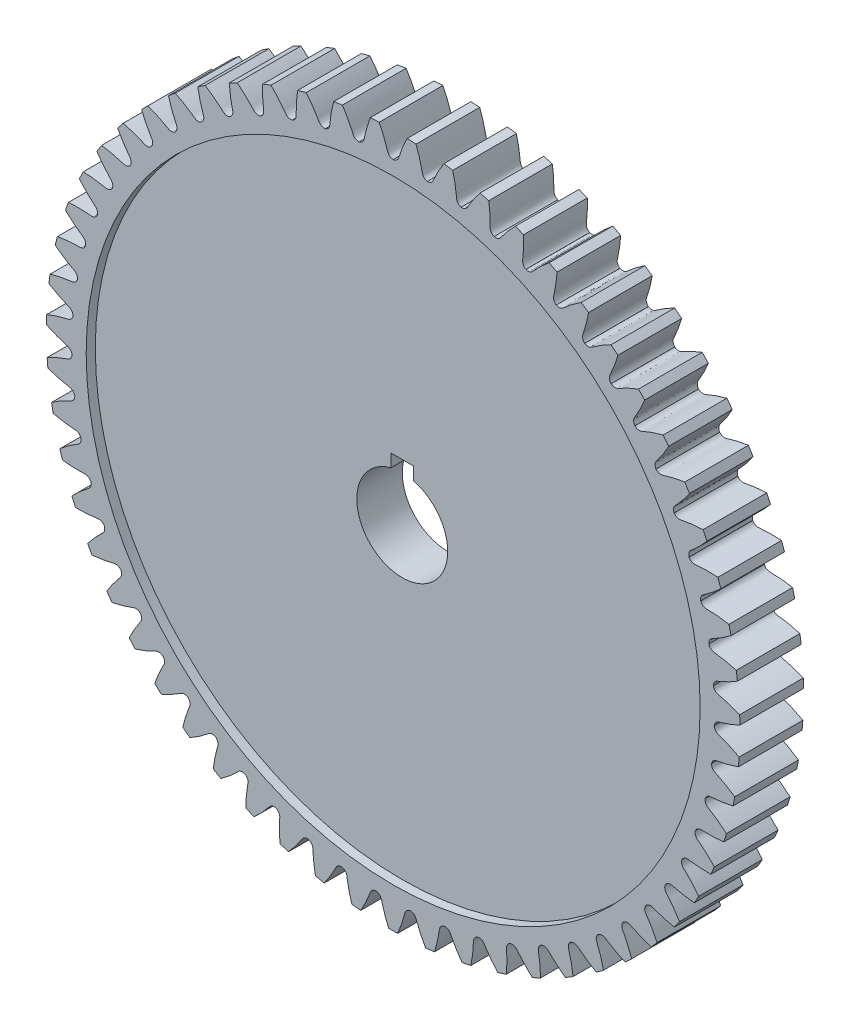
from build123d import *

# Parameters (mm, degrees)
SKETCH_1_R               = 76.25
EXTRUDE_1_DEPTH          = 30
CUT_EXTRUDE_1_DEPTH      = 112.929107028
PATTERN_CIRCULAR_1_COUNT = 59
CUT_EXTRUDE_2_DEPTH      = 60
SKETCH_5_R               = 102.301943374
CUT_EXTRUDE_3_DEPTH      = 16
SKETCH_6_R               = 67.5
CUT_EXTRUDE_4_DEPTH      = 2
CUT_EXTRUDE_START        = -2
SKETCH_7_R               = 67.5
CUT_EXTRUDE_5_DEPTH      = 2


with BuildPart() as part:
    # 草图1 → 凸台-拉伸1 (new body)
    with BuildSketch(Plane.XY):
        Circle(SKETCH_1_R)
    extrude(amount=EXTRUDE_1_DEPTH)

    # 草图2 → 切除-拉伸1 (cut, through all)
    with BuildSketch(Plane.XY):
        with BuildLine():
            ThreePointArc((0.01, 70.624915122), (0, 70.62491583), (-0.01, 70.624915122))
            add(Edge.make_bspline(
                [(-0.01, 70.624915122), (-1.072765247, 70.785715004), (-1.236088685, 71.64790065), (-1.552331687, 72.603417035), (-1.69871856, 73.026171753), (-1.863835529, 73.471498911), (-2.047763265, 73.939358412), (-2.251721525, 74.429004655), (-2.476576338, 74.939860258), (-2.723274787, 75.471261526), (-2.992717662, 76.022532973), (-3.285795326, 76.592966343), (-3.603376394, 77.18182727), (-3.946310034, 77.788353996), (-4.315424358, 78.411758394), (-4.711525962, 79.051226361), (-5.135399146, 79.705918404), (-5.587805243, 80.374970205), (-6.069481938, 81.057493203), (-6.581142606, 81.752575205), (-7.12347567, 82.459281001), (-7.697143946, 83.176653003), (-8.302784102, 83.903711896), (-8.941005772, 84.639457313), (-9.848574602, 85.644388189), (-10.561555039, 86.387164936), (-11.052843393, 86.87944586)],
                knots=[0, 0, 0, 0, 0.108464366, 0.129572035, 0.152074456, 0.17597163, 0.201263556, 0.227950233, 0.256031663, 0.285507845, 0.316378778, 0.348644464, 0.382304902, 0.417360092, 0.453810034, 0.491654728, 0.530894175, 0.571528373, 0.613557323, 0.656981026, 0.70179948, 0.748012687, 0.795620645, 0.844623356, 0.895020818, 1, 1, 1, 1], degree=3))
            ThreePointArc((-11.052843393, 86.87944586), (0, 87.579697762), (11.052843393, 86.87944586))
            add(Edge.make_bspline(
                [(0.01, 70.624915122), (1.072765247, 70.785715004), (1.236088685, 71.64790065), (1.552331687, 72.603417035), (1.69871856, 73.026171753), (1.863835529, 73.471498911), (2.047763265, 73.939358412), (2.251721525, 74.429004655), (2.476576338, 74.939860258), (2.723274787, 75.471261526), (2.992717662, 76.022532973), (3.285795326, 76.592966343), (3.603376394, 77.18182727), (3.946310034, 77.788353996), (4.315424358, 78.411758394), (4.711525962, 79.051226361), (5.135399146, 79.705918404), (5.587805243, 80.374970205), (6.069481938, 81.057493203), (6.581142606, 81.752575205), (7.12347567, 82.459281001), (7.697143946, 83.176653003), (8.302784102, 83.903711896), (8.941005772, 84.639457313), (9.848574602, 85.644388189), (10.561555039, 86.387164936), (11.052843393, 86.87944586)],
                knots=[0, 0, 0, 0, 0.108464366, 0.129572035, 0.152074456, 0.17597163, 0.201263556, 0.227950233, 0.256031663, 0.285507845, 0.316378778, 0.348644464, 0.382304902, 0.417360092, 0.453810034, 0.491654728, 0.530894175, 0.571528373, 0.613557323, 0.656981026, 0.70179948, 0.748012687, 0.795620645, 0.844623356, 0.895020818, 1, 1, 1, 1], degree=3))
        make_face()
    cut_extrude_1 = extrude(amount=CUT_EXTRUDE_1_DEPTH, mode=Mode.SUBTRACT)

    # 阵列(圆周)1: 切除-拉伸1 ×59 about axis
    pattern_circular_1_axis = Axis((0, 0, 30), (0, 0, -1))
    for i in range(1, PATTERN_CIRCULAR_1_COUNT):
        add(cut_extrude_1.rotate(pattern_circular_1_axis, i * 360 / PATTERN_CIRCULAR_1_COUNT), mode=Mode.SUBTRACT)

    # 草图4 → 切除-拉伸2 (cut)
    with BuildSketch(Plane.XY.offset(30)):
        with BuildLine():
            Line((-2.5, 12.5), (2.5, 12.5))
            Line((2.5, 12.5), (2.5, 9.682458366))
            ThreePointArc((2.5, 9.682458366), (0, -10), (-2.5, 9.682458366))
            Line((-2.5, 9.682458366), (-2.5, 12.5))
        make_face()
    extrude(amount=-CUT_EXTRUDE_2_DEPTH, mode=Mode.SUBTRACT)

    # 草图5 → 切除-拉伸3 (cut)
    with BuildSketch(Plane(origin=(0, 0, 0), x_dir=(-1, 0, 0), z_dir=(0, 0, -1))):
        Circle(SKETCH_5_R)
    extrude(amount=-CUT_EXTRUDE_3_DEPTH, mode=Mode.SUBTRACT)

    # 草图6 → 切除-拉伸4 (cut)
    with BuildSketch(Plane.XY.offset(30)):
        Circle(SKETCH_6_R)
    extrude(amount=-CUT_EXTRUDE_4_DEPTH, mode=Mode.SUBTRACT)

    # 草图7 → 切除-拉伸5 (cut)
    with BuildSketch(Plane(origin=(0, 0, 16), x_dir=(-1, 0, 0), z_dir=(0, 0, -1)).offset(CUT_EXTRUDE_START)):
        with Locations(Location((0, 0, 0), (0, 0, 180))):
            Circle(SKETCH_7_R)
    extrude(amount=CUT_EXTRUDE_5_DEPTH, mode=Mode.SUBTRACT)


solid = part.part
